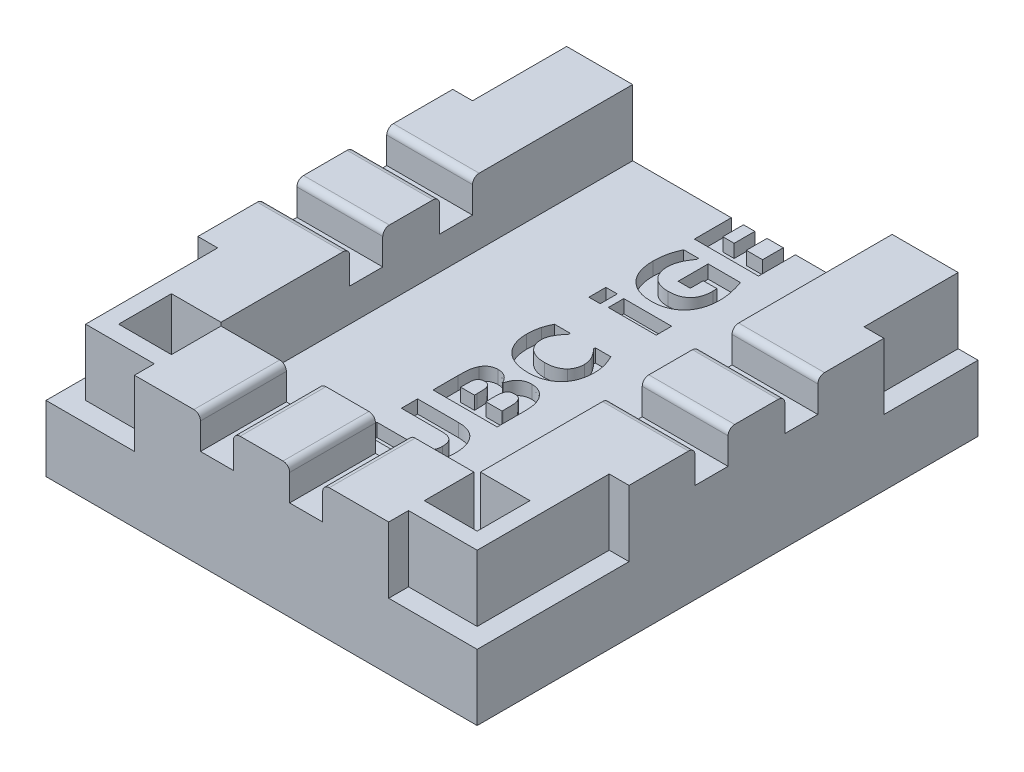
from build123d import *

# Parameters (mm, degrees)
SKETCH1_W                                  = 240
SKETCH1_H                                  = 200
BOSS_EXTRUDE1_DEPTH                        = 20
SKETCH7_W                                  = 120
SKETCH7_H                                  = 50
BOSS_EXTRUDE6_DEPTH                        = 20
FILLET1_R                                  = 2
SKETCH2_W                                  = 39.3
SKETCH2_H                                  = 125.7
CUT_EXTRUDE1_DEPTH                         = 10
CUT_EXTRUDE3_DEPTH                         = 5
MIRROR4_AT_THE_SECOND_PLANE_COPY_1_DEPTH   = 5
SKETCH11_W                                 = 104.748042719
SKETCH11_H                                 = 5
CUT_EXTRUDE4_DEPTH                         = 5
MIRROR6_AT_THE_SECOND_PLANE_COPY_1_SKETC_W = 104.748042719
MIRROR6_AT_THE_SECOND_PLANE_COPY_1_SKETC_H = 5
MIRROR6_AT_THE_SECOND_PLANE_COPY_1_DEPTH   = 5
SHELL1_START                               = 10
SHELL1_OUTLINE_W                           = 80.35
SHELL1_OUTLINE_H                           = 28.5
SHELL1_DEPTH                               = 10
FILLET3_R                                  = 1
SKETCH13_W                                 = 7.252545243
SKETCH13_H                                 = 2.335565418
SKETCH13_W_2                               = 1.720942939
SKETCH13_H_2                               = 2.581414408
CUT_EXTRUDE5_DEPTH                         = 2
CUT_EXTRUDE6_DEPTH                         = 10
MIRROR7_AT_THE_SECOND_PLANE_COPY_1_DEPTH   = 10
SKETCH15_W                                 = 101.789001661
SKETCH15_H                                 = 87.14110882
CUT_EXTRUDE7_DEPTH                         = 194.132079158
SKETCH16_W                                 = 296.201154453
SKETCH16_H                                 = 328.833485028
SKETCH16_W_2                               = 65.3
SKETCH16_H_2                               = 151.7
CUT_EXTRUDE10_DEPTH                        = 194.132079158
SKETCH17_W                                 = 70.628428311
SKETCH17_H                                 = 22.805656891
CUT_EXTRUDE11_DEPTH                        = 85.966140315


# Read off the part's stored shape, not the designer's step: Shell1
with BuildPart() as part:
    # Sketch1 → Boss-Extrude1 (new body)
    with BuildSketch(Plane(origin=(0, 0, 0), x_dir=(1, 0, 0), z_dir=(0, 1, 0))):
        Rectangle(SKETCH1_W, SKETCH1_H)
    extrude(amount=BOSS_EXTRUDE1_DEPTH)

    # Sketch7 → Boss-Extrude6 (add)
    with BuildSketch(Plane(origin=(0, 0, 0), x_dir=(1, 0, 0), z_dir=(0, 1, 0))):
        with Locations((0, 125)):
            Rectangle(SKETCH7_W, SKETCH7_H)
        with Locations((0, -125)):
            Rectangle(SKETCH7_W, SKETCH7_H)
    extrude(amount=BOSS_EXTRUDE6_DEPTH)

    # Fillet1
    fillet1_edges = [part.edges().sort_by_distance(p)[0] for p in [
        (-120, 20, 0),
        (90, 20, 100),
        (-90, 20, 100),
        (-60, 10, 150),
        (60, 10, 150),
        (-60, 20, 125),
        (0, 20, 150),
        (60, 20, 125),
        (-90, 20, -100),
        (60, 20, -125),
        (0, 20, -150),
        (60, 10, -150),
        (-60, 10, -150),
        (-60, 20, -125),
        (120, 20, 0),
        (120, 10, 100),
        (-120, 10, 100),
        (-120, 10, -100),
        (120, 10, -100),
        (90, 20, -100),
    ]]
    fillet(fillet1_edges, radius=FILLET1_R)

    # Sketch2 → Cut-Extrude1 (cut)
    with BuildSketch(Plane(origin=(0, 20, 0), x_dir=(1, 0, 0), z_dir=(0, 1, 0))):
        Rectangle(SKETCH2_W, SKETCH2_H)
    extrude(amount=-CUT_EXTRUDE1_DEPTH, mode=Mode.SUBTRACT)

    # Sketch10 → Cut-Extrude3 (cut)
    with BuildSketch(Plane(origin=(0, 20, 0), x_dir=(1, 0, 0), z_dir=(0, 1, 0))):
        Polygon((-9.25, -40.5), (-9.25, -33.162899401), (-4.25, -33.162899401), (-4.25, -40.5), (-4.25, -156.832928994), (-9.25, -156.832928994), align=None)
    cut_extrude3 = extrude(amount=-CUT_EXTRUDE3_DEPTH, mode=Mode.SUBTRACT)

    # Mirror4: Cut-Extrude3 across plane
    add(cut_extrude3.mirror(Plane(origin=(0, 0, 0), x_dir=(0, 0, 1), z_dir=(1, 0, 0))), mode=Mode.SUBTRACT)

    # Mirror4 at the second plane: Cut-Extrude3 across plane
    add(cut_extrude3.mirror(Plane.XY), mode=Mode.SUBTRACT)

    # Mirror4 at the second plane copy 1 sketc → Mirror4 at the second plane copy 1 (cut)
    with BuildSketch(Plane(origin=(0, 20, 0), x_dir=(-1, 0, 0), z_dir=(0, 1, 0))):
        Polygon((-9.25, -40.5), (-9.25, -33.162899401), (-4.25, -33.162899401), (-4.25, -40.5), (-4.25, -156.832928994), (-9.25, -156.832928994), align=None)
    extrude(amount=-MIRROR4_AT_THE_SECOND_PLANE_COPY_1_DEPTH, mode=Mode.SUBTRACT)

    # Sketch11 → Cut-Extrude4 (cut)
    with BuildSketch(Plane(origin=(0, 20, 0), x_dir=(1, 0, 0), z_dir=(0, 1, 0))):
        with Locations((-72.024021359, 26.75)):
            Rectangle(SKETCH11_W, SKETCH11_H)
        with Locations((-72.024021359, 40.35)):
            Rectangle(SKETCH11_W, SKETCH11_H)
    cut_extrude4 = extrude(amount=-CUT_EXTRUDE4_DEPTH, mode=Mode.SUBTRACT)

    # Mirror6: Cut-Extrude4 across plane
    add(cut_extrude4.mirror(Plane.XY), mode=Mode.SUBTRACT)

    # Mirror6 at the second plane: Cut-Extrude4 across plane
    add(cut_extrude4.mirror(Plane(origin=(0, 0, 0), x_dir=(0, 0, 1), z_dir=(1, 0, 0))), mode=Mode.SUBTRACT)

    # Mirror6 at the second plane copy 1 sketc → Mirror6 at the second plane copy 1 (cut)
    with BuildSketch(Plane(origin=(0, 20, 0), x_dir=(-1, 0, 0), z_dir=(0, 1, 0))):
        with Locations((-72.024021359, 26.75)):
            Rectangle(MIRROR6_AT_THE_SECOND_PLANE_COPY_1_SKETC_W, MIRROR6_AT_THE_SECOND_PLANE_COPY_1_SKETC_H)
        with Locations((-72.024021359, 40.35)):
            Rectangle(MIRROR6_AT_THE_SECOND_PLANE_COPY_1_SKETC_W, MIRROR6_AT_THE_SECOND_PLANE_COPY_1_SKETC_H)
    extrude(amount=-MIRROR6_AT_THE_SECOND_PLANE_COPY_1_DEPTH, mode=Mode.SUBTRACT)

    # Shell1 outline → Shell1 (cut)
    with BuildSketch(Plane(origin=(0, 0, 0), x_dir=(1, 0, 0), z_dir=(0, 1, 0)).offset(SHELL1_START)):
        Polygon((-29.65, 72.85), (-19.25, 72.85), (-19.25, 140), (-50, 140), (-50, 90), (-110, 90), (-110, 52.85), (-29.65, 52.85), align=None)
        Polygon((19.25, 72.85), (29.65, 72.85), (29.65, 52.85), (110, 52.85), (110, 90), (50, 90), (50, 140), (19.25, 140), align=None)
        Polygon((-110, -52.85), (-110, -90), (-50, -90), (-50, -140), (-19.25, -140), (-19.25, -72.85), (-29.65, -72.85), (-29.65, -52.85), align=None)
        with Locations((-69.825, 0)):
            Rectangle(SHELL1_OUTLINE_W, SHELL1_OUTLINE_H)
        Polygon((29.65, -72.85), (19.25, -72.85), (19.25, -140), (50, -140), (50, -90), (110, -90), (110, -52.85), (29.65, -52.85), align=None)
        with Locations((69.825, 0)):
            Rectangle(SHELL1_OUTLINE_W, SHELL1_OUTLINE_H)
    extrude(amount=SHELL1_DEPTH, mode=Mode.SUBTRACT)

    # Fillet3
    fillet3_edges = [part.edges().sort_by_distance(p)[0] for p in [
        (-4.25, 16.5, 150),
        (-4.25, 19.414213562, 149.414213562),
        (-9.25, 16.5, 150),
        (-9.25, 19.414213562, 149.414213562),
        (-4.25, 20, 105.425),
        (-9.25, 20, 105.425),
        (-9.25, 19.414213562, -149.414213562),
        (-9.25, 16.5, -150),
        (-9.25, 20, -105.425),
        (-4.25, 16.5, -150),
        (-4.25, 19.414213562, -149.414213562),
        (-4.25, 20, -105.425),
        (9.25, 16.5, 150),
        (9.25, 20, 105.425),
        (9.25, 19.414213562, 149.414213562),
        (4.25, 16.5, 150),
        (4.25, 19.414213562, 149.414213562),
        (4.25, 20, 105.425),
        (4.25, 16.5, -150),
        (4.25, 19.414213562, -149.414213562),
        (9.25, 19.414213562, -149.414213562),
        (9.25, 16.5, -150),
        (4.25, 20, -105.425),
        (9.25, 20, -105.425),
        (-120, 16.5, -24.25),
        (-120, 16.5, -29.25),
        (-119.414213562, 19.414213562, -24.25),
        (-119.414213562, 19.414213562, -29.25),
        (-68.825, 20, -24.25),
        (-68.825, 20, -29.25),
        (-120, 16.5, -37.85),
        (-120, 16.5, -42.85),
        (-68.825, 20, -37.85),
        (-68.825, 20, -42.85),
        (-119.414213562, 19.414213562, -37.85),
        (-119.414213562, 19.414213562, -42.85),
        (68.825, 20, -29.25),
        (119.414213562, 19.414213562, -29.25),
        (119.414213562, 19.414213562, -24.25),
        (68.825, 20, -24.25),
        (120, 16.5, -29.25),
        (120, 16.5, -24.25),
        (68.825, 20, -42.85),
        (119.414213562, 19.414213562, -42.85),
        (119.414213562, 19.414213562, -37.85),
        (68.825, 20, -37.85),
        (120, 16.5, -42.85),
        (120, 16.5, -37.85),
        (-120, 16.5, 29.25),
        (-120, 16.5, 24.25),
        (-68.825, 20, 29.25),
        (-119.414213562, 19.414213562, 29.25),
        (-119.414213562, 19.414213562, 24.25),
        (-68.825, 20, 24.25),
        (-120, 16.5, 42.85),
        (-120, 16.5, 37.85),
        (-68.825, 20, 42.85),
        (-119.414213562, 19.414213562, 42.85),
        (-119.414213562, 19.414213562, 37.85),
        (-68.825, 20, 37.85),
        (120, 16.5, 24.25),
        (120, 16.5, 29.25),
        (119.414213562, 19.414213562, 24.25),
        (119.414213562, 19.414213562, 29.25),
        (68.825, 20, 24.25),
        (68.825, 20, 29.25),
        (120, 16.5, 37.85),
        (120, 16.5, 42.85),
        (68.825, 20, 37.85),
        (68.825, 20, 42.85),
        (119.414213562, 19.414213562, 37.85),
        (119.414213562, 19.414213562, 42.85),
    ]]
    fillet(fillet3_edges, radius=FILLET3_R)

    # Sketch13 → Cut-Extrude5 (cut)
    # profile 1 of 12: a face of its own
    with BuildSketch(Plane(origin=(0, 10, 0), x_dir=(1, 0, 0), z_dir=(0, 1, 0))):
        Polygon((2.787359078, 56.729654742), (2.787359078, 55.37748529), (5, 55.37748529), (5, 53.041919872), (2.787359078, 53.041919872), (2.787359078, 48.247864542), (0.880108701, 48.247864542), (-4.711035156, 52.886343558), (-4.711035156, 55.37748529), (0.943491644, 55.37748529), (0.943491644, 56.729654742), align=None)
        Polygon((0.943491644, 53.041919872), (-2.596349692, 53.041919872), (0.943491644, 50.110938929), align=None, mode=Mode.SUBTRACT)
    # profile 2 of 12: a face of its own
    with BuildSketch(Plane(origin=(0, 10, 0), x_dir=(1, 0, 0), z_dir=(0, 1, 0))):
        with BuildLine():
            Line((5, 47.141544081), (5, 39.520225351))
            Line((5, 39.520225351), (3.409664338, 39.520225351))
            add(Edge.make_bspline(
                [(3.409664338, 39.520225351), (3.190599668, 39.81675512), (2.747057383, 40.417141716), (2.167094132, 41.14339637), (1.704390868, 41.703253096), (1.381972101, 42.083056551), (1.083256561, 42.417759603), (0.887687077, 42.622007507), (0.79559811, 42.718182933)],
                knots=[0, 0, 0, 0, 1.605452287, 3.25057426, 4.046675402, 4.768563423, 5.420146126, 6, 6, 6, 6], degree=3))
            add(Edge.make_bspline(
                [(0.79559811, 42.718182933), (0.732570292, 42.782561984), (0.609352585, 42.908421315), (0.423765416, 43.085974145), (0.244476812, 43.249198615), (0.074088064, 43.400664381), (-0.092796487, 43.534082219), (-0.252790737, 43.654099684), (-0.406497488, 43.759962438), (-0.599845109, 43.881290453), (-0.837875375, 44.00401532), (-1.125540586, 44.112139625), (-1.412736444, 44.178491494), (-1.604945873, 44.187117789), (-1.699385013, 44.191356186)],
                knots=[0, 0, 0, 0, 1.090093853, 2.131104457, 3.107135244, 4.023908394, 4.888948297, 5.691514549, 6.4435893, 7.146498757, 8.452673016, 9.675803408, 10.85804184, 12, 12, 12, 12], degree=3))
            add(Edge.make_bspline(
                [(-1.699385013, 44.191356186), (-1.754483363, 44.189605987), (-1.861179083, 44.186216799), (-2.017224671, 44.167846758), (-2.162681909, 44.132103765), (-2.300488192, 44.087839319), (-2.42643972, 44.024206924), (-2.544199113, 43.950411254), (-2.650531499, 43.859818439), (-2.749307162, 43.758726543), (-2.834556733, 43.642742478), (-2.911599654, 43.517157005), (-2.971430142, 43.377241787), (-3.024398474, 43.226819474), (-3.063653395, 43.063897589), (-3.092633036, 42.889340485), (-3.109905835, 42.703165878), (-3.111960528, 42.574807759), (-3.113016713, 42.508827152)],
                knots=[0, 0, 0, 0, 1.058578686, 2.049894692, 3.010224385, 3.931750511, 4.822578239, 5.71281177, 6.594427321, 7.498813824, 8.420995957, 9.353043897, 10.321837571, 11.3367408, 12.413304787, 13.535187771, 14.732999458, 16, 16, 16, 16], degree=3))
            add(Edge.make_bspline(
                [(-3.113016713, 42.508827152), (-3.110052719, 42.405568465), (-3.104041103, 42.196137688), (-3.053985994, 41.878413923), (-2.980602684, 41.552282773), (-2.873221808, 41.222921491), (-2.74714341, 40.895094854), (-2.596251992, 40.578640505), (-2.438170844, 40.269132893), (-2.314289691, 40.074405983), (-2.252545243, 39.977350819)],
                knots=[0, 0, 0, 0, 0.914703558, 1.855215137, 2.844920106, 3.875005138, 4.922433174, 5.955639304, 6.981056277, 8, 8, 8, 8], degree=3))
            Line((-2.252545243, 39.977350819), (-2.252545243, 39.766074342))
            Line((-2.252545243, 39.766074342), (-4.363389317, 39.766074342))
            add(Edge.make_bspline(
                [(-4.363389317, 39.766074342), (-4.396975153, 39.85152697), (-4.470639347, 40.038951181), (-4.568658946, 40.352153969), (-4.66491051, 40.720660415), (-4.763825821, 41.132864511), (-4.849735205, 41.573321973), (-4.910075419, 42.024211578), (-4.95119256, 42.474770211), (-4.954991729, 42.775713815), (-4.956884148, 42.92561802)],
                knots=[0, 0, 0, 0, 0.681686624, 1.495150967, 2.435076171, 3.509887788, 4.642826517, 5.765734475, 6.887081194, 8, 8, 8, 8], degree=3))
            add(Edge.make_bspline(
                [(-4.956884148, 42.92561802), (-4.954912362, 43.072306092), (-4.951074185, 43.357841566), (-4.914531776, 43.772464491), (-4.853049644, 44.160650299), (-4.769612134, 44.521836328), (-4.662431161, 44.856562797), (-4.529987596, 45.163893905), (-4.371768891, 45.443672956), (-4.191325, 45.69718541), (-3.986517109, 45.920499957), (-3.762299213, 46.116633841), (-3.516918106, 46.283180062), (-3.250583577, 46.417510178), (-2.964907945, 46.521931142), (-2.659732708, 46.596780352), (-2.333869778, 46.641015432), (-2.109911454, 46.646854566), (-1.995172081, 46.649846099)],
                knots=[0, 0, 0, 0, 1.302669921, 2.535710425, 3.693104205, 4.791067539, 5.825099944, 6.810730835, 7.758000335, 8.67487823, 9.568447078, 10.443087854, 11.315285082, 12.19521531, 13.085757283, 14.011200708, 14.981089066, 16, 16, 16, 16], degree=3))
            add(Edge.make_bspline(
                [(-1.995172081, 46.649846099), (-1.918295051, 46.648245135), (-1.764899121, 46.645050664), (-1.536586701, 46.623146341), (-1.311198259, 46.589276583), (-1.089189633, 46.538876948), (-0.870129482, 46.472993238), (-0.653296175, 46.39436831), (-0.439122967, 46.302496277), (-0.229338943, 46.193054838), (-0.018163961, 46.072147599), (0.191952814, 45.932794317), (0.405837655, 45.781094454), (0.620958688, 45.614342324), (0.835471411, 45.430057751), (1.055741697, 45.23549192), (1.273520634, 45.021368665), (1.417594688, 44.872241147), (1.490889788, 44.796375188)],
                knots=[0, 0, 0, 0, 0.907170522, 1.810115022, 2.704515666, 3.595334857, 4.494160497, 5.402400165, 6.316123003, 7.242010315, 8.19323076, 9.186549597, 10.215937183, 11.28746875, 12.397107329, 13.552885457, 14.755074217, 16, 16, 16, 16], degree=3))
            add(Edge.make_bspline(
                [(1.490889788, 44.796375188), (1.669671754, 44.600991906), (2.021428479, 44.216571794), (2.422503942, 43.720261203), (2.710127438, 43.347225494), (2.892573427, 43.11547907), (3.035611297, 42.923413887), (3.11966375, 42.809753418), (3.156132565, 42.760438229)],
                knots=[0, 0, 0, 0, 1.811045763, 3.563265038, 4.362127914, 5.033096026, 5.580478129, 6, 6, 6, 6], degree=3))
            Line((3.156132565, 42.760438229), (3.156132565, 47.141544081))
            Line((3.156132565, 47.141544081), (5, 47.141544081))
        make_face()
    # profile 3 of 12: a face of its own
    with BuildSketch(Plane(origin=(0, 10, 0), x_dir=(1, 0, 0), z_dir=(0, 1, 0))):
        with BuildLine():
            add(Edge.make_bspline(
                [(0.138720336, 37.553433421), (0.339837036, 37.551198694), (0.731017162, 37.546852061), (1.301575539, 37.503210957), (1.839727263, 37.435290008), (2.344336806, 37.340402007), (2.812295891, 37.218717557), (3.235819492, 37.059739443), (3.620265586, 36.877229499), (3.845547684, 36.720963882), (3.955141787, 36.64494457)],
                knots=[0, 0, 0, 0, 1.210994604, 2.355433537, 3.443919748, 4.476135166, 5.446013627, 6.351277171, 7.197937607, 8, 8, 8, 8], degree=3))
            add(Edge.make_bspline(
                [(3.955141787, 36.64494457), (4.057367971, 36.5617232), (4.260610648, 36.396265258), (4.524020765, 36.101981434), (4.745368417, 35.772676286), (4.897303004, 35.472877401), (4.999247268, 35.217133399), (5.063592063, 35.011802969), (5.122267484, 34.796985151), (5.167723638, 34.570405454), (5.201934481, 34.333084121), (5.226664862, 34.085073274), (5.242295446, 33.825562266), (5.244648027, 33.648682389), (5.245848991, 33.558387312)],
                knots=[0, 0, 0, 0, 1.363120718, 2.710110989, 4.070537742, 5.460816644, 6.180869889, 6.918733188, 7.687278466, 8.485437086, 9.309407483, 10.168795045, 11.065191617, 12, 12, 12, 12], degree=3))
            add(Edge.make_bspline(
                [(5.245848991, 33.558387312), (5.241905689, 33.384062955), (5.234297073, 33.047703496), (5.173081199, 32.562988904), (5.069699732, 32.118069919), (4.926806373, 31.711596248), (4.739854178, 31.34454147), (4.516760058, 31.013155063), (4.251279595, 30.717979546), (4.045332533, 30.554230832), (3.94169692, 30.471830054)],
                knots=[0, 0, 0, 0, 1.200851745, 2.317047666, 3.359233085, 4.342911255, 5.278031965, 6.189548012, 7.088953741, 8, 8, 8, 8], degree=3))
            add(Edge.make_bspline(
                [(3.94169692, 30.471830054), (3.829424185, 30.3947628), (3.600170882, 30.2373967), (3.214838014, 30.049115343), (2.792701976, 29.89168932), (2.331256748, 29.768085058), (1.834031119, 29.675388633), (1.301418942, 29.61187027), (0.734794995, 29.570336966), (0.344952566, 29.565716964), (0.144482422, 29.563341204)],
                knots=[0, 0, 0, 0, 0.822750793, 1.680001256, 2.58557045, 3.544707477, 4.565467581, 5.642347189, 6.787615291, 8, 8, 8, 8], degree=3))
            add(Edge.make_bspline(
                [(0.144482422, 29.563341204), (-0.061754837, 29.565532126), (-0.459970452, 29.569762495), (-1.036345286, 29.613069323), (-1.570746564, 29.680774054), (-2.065452333, 29.775711056), (-2.521358164, 29.900947264), (-2.938473361, 30.06222162), (-3.323134476, 30.249194002), (-3.55325365, 30.406272972), (-3.666176943, 30.483354226)],
                knots=[0, 0, 0, 0, 1.242237956, 2.39858964, 3.479780431, 4.485821505, 5.430991799, 6.32348679, 7.177307181, 8, 8, 8, 8], degree=3))
            add(Edge.make_bspline(
                [(-3.666176943, 30.483354226), (-3.769193286, 30.566416838), (-3.974708441, 30.732124775), (-4.238285133, 31.029639616), (-4.461065672, 31.362253167), (-4.645070962, 31.729678272), (-4.784115122, 32.135791847), (-4.885860052, 32.577168574), (-4.944671996, 33.056148657), (-4.952723667, 33.387282789), (-4.956884148, 33.558387312)],
                knots=[0, 0, 0, 0, 0.915406887, 1.826214983, 2.74012738, 3.682217607, 4.664024873, 5.706462388, 6.814877053, 8, 8, 8, 8], degree=3))
            add(Edge.make_bspline(
                [(-4.956884148, 33.558387312), (-4.955682618, 33.64868302), (-4.953320425, 33.826203271), (-4.937576888, 34.086978277), (-4.913381513, 34.337057391), (-4.877300412, 34.575699285), (-4.828262853, 34.80214551), (-4.773499009, 35.018778584), (-4.706561244, 35.224310597), (-4.601886899, 35.480626422), (-4.447267393, 35.781827029), (-4.217150947, 36.109134402), (-3.948246131, 36.405401156), (-3.739143401, 36.569659884), (-3.633525124, 36.652627351)],
                knots=[0, 0, 0, 0, 0.927772364, 1.823989051, 2.683453821, 3.508702832, 4.302191287, 5.063276402, 5.803871599, 6.520953588, 7.906777029, 9.27188215, 10.622021304, 12, 12, 12, 12], degree=3))
            add(Edge.make_bspline(
                [(-3.633525124, 36.652627351), (-3.521300204, 36.729189524), (-3.292789343, 36.885084383), (-2.908970475, 37.068290297), (-2.492360426, 37.225455121), (-2.036263275, 37.346342452), (-1.54437137, 37.439204828), (-1.015826808, 37.505677425), (-0.450933502, 37.546286922), (-0.061742996, 37.551003841), (0.138720336, 37.553433421)],
                knots=[0, 0, 0, 0, 0.826423845, 1.682753026, 2.582377666, 3.535958882, 4.552416628, 5.629628825, 6.779074777, 8, 8, 8, 8], degree=3))
        make_face()
        with BuildLine():
            add(Edge.make_bspline(
                [(0.138720336, 35.094943508), (-0.002794049, 35.093990238), (-0.275052116, 35.092156251), (-0.667644343, 35.074004214), (-1.028464631, 35.048543297), (-1.357952356, 35.010483072), (-1.656192237, 34.961169576), (-1.923473104, 34.900935006), (-2.158488294, 34.828227196), (-2.363936988, 34.745989678), (-2.54162794, 34.64913888), (-2.69467252, 34.537908006), (-2.823572221, 34.410664927), (-2.931286275, 34.270097317), (-3.011274034, 34.111739825), (-3.072443859, 33.941187009), (-3.106785969, 33.754382189), (-3.110895684, 33.625106618), (-3.113016713, 33.558387312)],
                knots=[0, 0, 0, 0, 1.684598718, 3.240982106, 4.677870026, 5.990101975, 7.188004416, 8.275163324, 9.249099904, 10.113910365, 10.905306099, 11.652292794, 12.358339015, 13.054983843, 13.750418457, 14.461547751, 15.206002611, 16, 16, 16, 16], degree=3))
            add(Edge.make_bspline(
                [(-3.113016713, 33.558387312), (-3.110895681, 33.491668012), (-3.106785962, 33.362392453), (-3.072443884, 33.175587552), (-3.011273943, 33.005035023), (-2.931286606, 32.84667649), (-2.823570979, 32.706112772), (-2.694677343, 32.578854684), (-2.541608299, 32.467684345), (-2.363496496, 32.37029911), (-2.157013742, 32.289020864), (-1.921590867, 32.215742751), (-1.654258135, 32.155647372), (-1.355414385, 32.106122047), (-1.024612933, 32.068276855), (-0.661244964, 32.04269777), (-0.266085327, 32.024665897), (0.008090715, 32.022799039), (0.150244508, 32.021831116)],
                knots=[0, 0, 0, 0, 0.791766581, 1.534129826, 2.243261137, 2.936741863, 3.631429404, 4.335491923, 5.08037989, 5.869552125, 6.738971147, 7.710171362, 8.794275798, 9.988812621, 11.304907075, 12.745337551, 14.312534512, 16, 16, 16, 16], degree=3))
            add(Edge.make_bspline(
                [(0.150244508, 32.021831116), (0.289201434, 32.022765136), (0.556986265, 32.024565091), (0.943773412, 32.043063349), (1.30096878, 32.067483158), (1.627502144, 32.109075315), (1.924420257, 32.156514098), (2.190195476, 32.220950105), (2.427221865, 32.292197549), (2.635687527, 32.376524358), (2.816464841, 32.475577579), (2.974492505, 32.586386469), (3.106149375, 32.714997304), (3.215613674, 32.855867424), (3.298888327, 33.012083539), (3.358752163, 33.181622444), (3.396338685, 33.365314373), (3.400067537, 33.492898418), (3.401981557, 33.558387312)],
                knots=[0, 0, 0, 0, 1.658832269, 3.196746878, 4.622488866, 5.931787449, 7.125569234, 8.210133994, 9.194149195, 10.078471196, 10.889203548, 11.650697572, 12.375032472, 13.07829054, 13.77251817, 14.478471121, 15.218999177, 16, 16, 16, 16], degree=3))
            add(Edge.make_bspline(
                [(3.401981557, 33.558387312), (3.400068186, 33.623876875), (3.3963406, 33.751462223), (3.358745104, 33.935144911), (3.298913291, 34.10471679), (3.215521541, 34.260812329), (3.106775331, 34.40178813), (2.97377315, 34.528364287), (2.816557237, 34.639341559), (2.635707586, 34.738476019), (2.42683161, 34.821967534), (2.190341985, 34.897522561), (1.921851262, 34.956560743), (1.624132619, 35.009519497), (1.295502071, 35.045529443), (0.936895825, 35.074962985), (0.547988509, 35.091838226), (0.278306115, 35.093884415), (0.138720336, 35.094943508)],
                knots=[0, 0, 0, 0, 0.778971247, 1.517574904, 2.221693305, 2.914116855, 3.615547377, 4.332711038, 5.092226179, 5.900851692, 6.782875619, 7.766611013, 8.854037796, 10.053520173, 11.366075456, 12.788704916, 14.337855446, 16, 16, 16, 16], degree=3))
        make_face(mode=Mode.SUBTRACT)
    # profile 4 of 12: a face of its own
    with BuildSketch(Plane(origin=(0, 10, 0), x_dir=(1, 0, 0), z_dir=(0, 1, 0))):
        with BuildLine():
            Line((5, 28.211171751), (5, 20.589853021))
            Line((5, 20.589853021), (3.409664338, 20.589853021))
            add(Edge.make_bspline(
                [(3.409664338, 20.589853021), (3.190599668, 20.88638279), (2.747057383, 21.486769386), (2.167094132, 22.21302404), (1.704390868, 22.772880767), (1.381972101, 23.152684221), (1.083256561, 23.487387273), (0.887687077, 23.691635177), (0.79559811, 23.787810603)],
                knots=[0, 0, 0, 0, 1.605452287, 3.25057426, 4.046675402, 4.768563423, 5.420146126, 6, 6, 6, 6], degree=3))
            add(Edge.make_bspline(
                [(0.79559811, 23.787810603), (0.732570292, 23.852189654), (0.609352585, 23.978048985), (0.423765416, 24.155601815), (0.244476812, 24.318826285), (0.074088064, 24.470292051), (-0.092796487, 24.60370989), (-0.252790737, 24.723727355), (-0.406497488, 24.829590108), (-0.599845109, 24.950918123), (-0.837875375, 25.07364299), (-1.125540586, 25.181767295), (-1.412736444, 25.248119164), (-1.604945873, 25.256745459), (-1.699385013, 25.260983856)],
                knots=[0, 0, 0, 0, 1.090093853, 2.131104457, 3.107135244, 4.023908394, 4.888948297, 5.691514549, 6.4435893, 7.146498757, 8.452673016, 9.675803408, 10.85804184, 12, 12, 12, 12], degree=3))
            add(Edge.make_bspline(
                [(-1.699385013, 25.260983856), (-1.754483363, 25.259233658), (-1.861179083, 25.25584447), (-2.017224671, 25.237474428), (-2.162681909, 25.201731435), (-2.300488192, 25.157466989), (-2.42643972, 25.093834595), (-2.544199113, 25.020038924), (-2.650531499, 24.929446109), (-2.749307162, 24.828354213), (-2.834556733, 24.712370148), (-2.911599654, 24.586784675), (-2.971430142, 24.446869457), (-3.024398474, 24.296447144), (-3.063653395, 24.133525259), (-3.092633036, 23.958968155), (-3.109905835, 23.772793548), (-3.111960528, 23.644435429), (-3.113016713, 23.578454822)],
                knots=[0, 0, 0, 0, 1.058578686, 2.049894692, 3.010224385, 3.931750511, 4.822578239, 5.71281177, 6.594427321, 7.498813824, 8.420995957, 9.353043897, 10.321837571, 11.3367408, 12.413304787, 13.535187771, 14.732999458, 16, 16, 16, 16], degree=3))
            add(Edge.make_bspline(
                [(-3.113016713, 23.578454822), (-3.110052719, 23.475196136), (-3.104041103, 23.265765358), (-3.053985994, 22.948041593), (-2.980602684, 22.621910443), (-2.873221808, 22.292549161), (-2.74714341, 21.964722525), (-2.596251992, 21.648268175), (-2.438170844, 21.338760563), (-2.314289691, 21.144033653), (-2.252545243, 21.046978489)],
                knots=[0, 0, 0, 0, 0.914703558, 1.855215137, 2.844920106, 3.875005138, 4.922433174, 5.955639304, 6.981056277, 8, 8, 8, 8], degree=3))
            Line((-2.252545243, 21.046978489), (-2.252545243, 20.835702012))
            Line((-2.252545243, 20.835702012), (-4.363389317, 20.835702012))
            add(Edge.make_bspline(
                [(-4.363389317, 20.835702012), (-4.396975153, 20.92115464), (-4.470639347, 21.108578851), (-4.568658946, 21.421781639), (-4.66491051, 21.790288086), (-4.763825821, 22.202492181), (-4.849735205, 22.642949643), (-4.910075419, 23.093839248), (-4.95119256, 23.544397881), (-4.954991729, 23.845341485), (-4.956884148, 23.99524569)],
                knots=[0, 0, 0, 0, 0.681686624, 1.495150967, 2.435076171, 3.509887788, 4.642826517, 5.765734475, 6.887081194, 8, 8, 8, 8], degree=3))
            add(Edge.make_bspline(
                [(-4.956884148, 23.99524569), (-4.954912362, 24.141933762), (-4.951074185, 24.427469237), (-4.914531776, 24.842092162), (-4.853049644, 25.230277969), (-4.769612134, 25.591463998), (-4.662431161, 25.926190468), (-4.529987596, 26.233521576), (-4.371768891, 26.513300626), (-4.191325, 26.76681308), (-3.986517109, 26.990127627), (-3.762299213, 27.186261512), (-3.516918106, 27.352807733), (-3.250583577, 27.487137848), (-2.964907945, 27.591558812), (-2.659732708, 27.666408023), (-2.333869778, 27.710643103), (-2.109911454, 27.716482236), (-1.995172081, 27.719473769)],
                knots=[0, 0, 0, 0, 1.302669921, 2.535710425, 3.693104205, 4.791067539, 5.825099944, 6.810730835, 7.758000335, 8.67487823, 9.568447078, 10.443087854, 11.315285082, 12.19521531, 13.085757283, 14.011200708, 14.981089066, 16, 16, 16, 16], degree=3))
            add(Edge.make_bspline(
                [(-1.995172081, 27.719473769), (-1.918295051, 27.717872805), (-1.764899121, 27.714678334), (-1.536586701, 27.692774011), (-1.311198259, 27.658904253), (-1.089189633, 27.608504619), (-0.870129482, 27.542620908), (-0.653296175, 27.46399598), (-0.439122967, 27.372123947), (-0.229338943, 27.262682508), (-0.018163961, 27.141775269), (0.191952814, 27.002421987), (0.405837655, 26.850722124), (0.620958688, 26.683969994), (0.835471411, 26.499685422), (1.055741697, 26.30511959), (1.273520634, 26.090996335), (1.417594688, 25.941868817), (1.490889788, 25.866002858)],
                knots=[0, 0, 0, 0, 0.907170522, 1.810115022, 2.704515666, 3.595334857, 4.494160497, 5.402400165, 6.316123003, 7.242010315, 8.19323076, 9.186549597, 10.215937183, 11.28746875, 12.397107329, 13.552885457, 14.755074217, 16, 16, 16, 16], degree=3))
            add(Edge.make_bspline(
                [(1.490889788, 25.866002858), (1.669671754, 25.670619576), (2.021428479, 25.286199464), (2.422503942, 24.789888873), (2.710127438, 24.416853164), (2.892573427, 24.18510674), (3.035611297, 23.993041557), (3.11966375, 23.879381088), (3.156132565, 23.830065899)],
                knots=[0, 0, 0, 0, 1.811045763, 3.563265038, 4.362127914, 5.033096026, 5.580478129, 6, 6, 6, 6], degree=3))
            Line((3.156132565, 23.830065899), (3.156132565, 28.211171751))
            Line((3.156132565, 28.211171751), (5, 28.211171751))
        make_face()
    # profile 5 of 12: a face of its own
    with BuildSketch(Plane(origin=(0, 10, 0), x_dir=(1, 0, 0), z_dir=(0, 1, 0))):
        Polygon((5, 13.583156769), (5, 11.124666856), (-1.524601746, 11.124666856), (2.664434583, 9.338420279), (2.664434583, 7.625160121), (-1.524601746, 5.838913543), (5, 5.838913543), (5, 3.503348126), (-4.711035156, 3.503348126), (-4.711035156, 6.382470298), (0.125275469, 8.549014533), (-4.711035156, 10.709796683), (-4.711035156, 13.583156769), align=None)
    # profile 6 of 12: a face of its own
    with BuildSketch(Plane(origin=(0, 10, 0), x_dir=(1, 0, 0), z_dir=(0, 1, 0))):
        Polygon((5, 1.4136317), (5, -5.593064552), (-4.711035156, -5.593064552), (-4.711035156, 1.4136317), (-2.867167722, 1.4136317), (-2.867167722, -3.134574639), (-1.146224782, -3.134574639), (-1.146224782, 1.044858213), (0.697642652, 1.044858213), (0.697642652, -3.134574639), (3.156132565, -3.134574639), (3.156132565, 1.4136317), align=None)
    # profile 7 of 12: a face of its own
    with BuildSketch(Plane(origin=(0, 10, 0), x_dir=(1, 0, 0), z_dir=(0, 1, 0))):
        with BuildLine():
            add(Edge.make_bspline(
                [(4.475650198, -7.805705474), (4.519354839, -7.923859504), (4.612512661, -8.17570855), (4.743574124, -8.583890089), (4.866671289, -9.047274178), (4.996208031, -9.552124696), (5.106381276, -10.084227717), (5.187397941, -10.625264318), (5.237323662, -11.165972628), (5.243010567, -11.526628491), (5.245848991, -11.706637515)],
                knots=[0, 0, 0, 0, 0.756485239, 1.612472169, 2.573171414, 3.635272123, 4.742182008, 5.834553763, 6.919191659, 8, 8, 8, 8], degree=3))
            add(Edge.make_bspline(
                [(5.245848991, -11.706637515), (5.241962961, -11.909112321), (5.234392087, -12.303579456), (5.17063924, -12.878829296), (5.062937634, -13.419584917), (4.916847086, -13.928231287), (4.72267015, -14.400885619), (4.491042888, -14.842463027), (4.211679163, -15.247896521), (3.893490591, -15.618759753), (3.53655883, -15.9505899), (3.145758166, -16.239699566), (2.72146993, -16.48347792), (2.264846611, -16.681095463), (1.776896349, -16.838089964), (1.255150105, -16.944841813), (0.702111097, -17.014888699), (0.322052776, -17.021601157), (0.127196165, -17.025042647)],
                knots=[0, 0, 0, 0, 1.160705024, 2.261318311, 3.313123859, 4.319096107, 5.290496718, 6.238021168, 7.172737693, 8.107230733, 9.03451477, 9.961071912, 10.888559376, 11.833805606, 12.808979065, 13.821966168, 14.883317984, 16, 16, 16, 16], degree=3))
            add(Edge.make_bspline(
                [(0.127196165, -17.025042647), (-0.058682323, -17.02067815), (-0.422730133, -17.012130168), (-0.955049114, -16.943336637), (-1.460067022, -16.832867692), (-1.937766829, -16.677677821), (-2.386372436, -16.473696921), (-2.808700267, -16.227656485), (-3.203463564, -15.935836699), (-3.565000576, -15.598836264), (-3.895700628, -15.226075236), (-4.177610929, -14.810267907), (-4.422741814, -14.363406013), (-4.616779655, -13.8775432), (-4.772219277, -13.359136807), (-4.876169413, -12.804694831), (-4.946971316, -12.216810998), (-4.953520434, -11.812500101), (-4.956884148, -11.604840667)],
                knots=[0, 0, 0, 0, 1.061573339, 2.079118747, 3.060574866, 4.011305467, 4.942696719, 5.870461571, 6.798745348, 7.740825567, 8.68941507, 9.638984161, 10.604583371, 11.595514188, 12.621960228, 13.691449096, 14.814297672, 16, 16, 16, 16], degree=3))
            add(Edge.make_bspline(
                [(-4.956884148, -11.604840667), (-4.954318925, -11.445386322), (-4.949235323, -11.129389392), (-4.919388643, -10.661251886), (-4.863951384, -10.205248288), (-4.792453594, -9.753475749), (-4.684946461, -9.294730481), (-4.534849919, -8.818874824), (-4.346707534, -8.316660693), (-4.193287983, -7.980233106), (-4.113698935, -7.805705474)],
                knots=[0, 0, 0, 0, 0.974479143, 1.931163549, 2.86485946, 3.780778834, 4.725046501, 5.741022375, 6.828116267, 8, 8, 8, 8], degree=3))
            Line((-4.113698935, -7.805705474), (-1.883771756, -7.805705474))
            Line((-1.883771756, -7.805705474), (-1.883771756, -8.091889065))
            add(Edge.make_bspline(
                [(-1.883771756, -8.091889065), (-1.906716104, -8.126531064), (-1.957410079, -8.203070203), (-2.043059993, -8.326945943), (-2.137489474, -8.476111594), (-2.284548962, -8.694884397), (-2.45960062, -8.978067997), (-2.581693909, -9.213466955), (-2.640525683, -9.326896107)],
                knots=[0, 0, 0, 0, 0.515980687, 1.140024195, 1.869947604, 2.707876564, 4.413660046, 6, 6, 6, 6], degree=3))
            add(Edge.make_bspline(
                [(-2.640525683, -9.326896107), (-2.672756546, -9.393740863), (-2.73882048, -9.530753251), (-2.823836627, -9.749019276), (-2.905177649, -9.981830174), (-2.978097, -10.22950925), (-3.037034138, -10.489919732), (-3.082413494, -10.759686706), (-3.106467195, -11.03779789), (-3.110821171, -11.225783758), (-3.113016713, -11.320577771)],
                knots=[0, 0, 0, 0, 0.861448091, 1.765719082, 2.717953576, 3.724891765, 4.761927522, 5.816719679, 6.89905606, 8, 8, 8, 8], degree=3))
            add(Edge.make_bspline(
                [(-3.113016713, -11.320577771), (-3.110164997, -11.430782772), (-3.104578279, -11.646682304), (-3.068710383, -11.963218824), (-3.004292393, -12.263584213), (-2.918860854, -12.549882667), (-2.805175217, -12.820581595), (-2.662381265, -13.075068024), (-2.499039638, -13.320076357), (-2.36711736, -13.466852812), (-2.300562624, -13.540901474)],
                knots=[0, 0, 0, 0, 1.091217493, 2.137773647, 3.148547478, 4.129133693, 5.092188092, 6.048375109, 7.015406034, 8, 8, 8, 8], degree=3))
            add(Edge.make_bspline(
                [(-2.300562624, -13.540901474), (-2.231129169, -13.608753509), (-2.090799964, -13.745886571), (-1.846186727, -13.91943259), (-1.579009792, -14.07619004), (-1.283734201, -14.208811415), (-0.962723927, -14.314570988), (-0.616833633, -14.387928819), (-0.248028071, -14.435679856), (0.006035391, -14.440927383), (0.136799641, -14.443628239)],
                knots=[0, 0, 0, 0, 0.871242595, 1.760833901, 2.686460846, 3.652134751, 4.663748384, 5.717797841, 6.825370436, 8, 8, 8, 8], degree=3))
            add(Edge.make_bspline(
                [(0.136799641, -14.443628239), (0.270078203, -14.441217619), (0.528956778, -14.436535262), (0.904701948, -14.395518364), (1.257245759, -14.329288021), (1.585144219, -14.233472949), (1.889752999, -14.11198958), (2.170660406, -13.964565335), (2.424839249, -13.78559248), (2.657673098, -13.584235453), (2.862193118, -13.352834409), (3.041867765, -13.096983341), (3.191530728, -12.813783401), (3.315763592, -12.506455713), (3.407777269, -12.172177215), (3.477785429, -11.813452581), (3.51753353, -11.428392977), (3.522401475, -11.163169785), (3.524906052, -11.026711399)],
                knots=[0, 0, 0, 0, 1.162877018, 2.258757441, 3.29433279, 4.289818334, 5.235063129, 6.152415668, 7.05144509, 7.94239879, 8.832861761, 9.739671241, 10.664582224, 11.622279774, 12.626959197, 13.685538709, 14.809200461, 16, 16, 16, 16], degree=3))
            add(Edge.make_bspline(
                [(3.524906052, -11.026711399), (3.524545414, -10.976125561), (3.523787414, -10.869802624), (3.51698298, -10.707868976), (3.511542352, -10.544994826), (3.50110347, -10.438303115), (3.496095624, -10.387119882)],
                knots=[0, 0, 0, 0, 0.947728294, 1.991965744, 3.036685378, 4, 4, 4, 4], degree=3))
            Line((3.496095624, -10.387119882), (1.435189626, -10.387119882))
            Line((1.435189626, -10.387119882), (1.435189626, -12.353911813))
            Line((1.435189626, -12.353911813), (-0.408677809, -12.353911813))
            Line((-0.408677809, -12.353911813), (-0.408677809, -7.805705474))
            Line((-0.408677809, -7.805705474), (4.475650198, -7.805705474))
        make_face()
    # profile 8 of 12: a face of its own
    with BuildSketch(Plane(origin=(0, 10, 0), x_dir=(1, 0, 0), z_dir=(0, 1, 0))):
        with Locations((1.373727378, -19.913768295)):
            Rectangle(SKETCH13_W, SKETCH13_H)
    # profile 9 of 12: a face of its own
    with BuildSketch(Plane(origin=(0, 10, 0), x_dir=(1, 0, 0), z_dir=(0, 1, 0))):
        with Locations((-4.219337174, -19.913768295)):
            Rectangle(SKETCH13_W_2, SKETCH13_H_2)
    # profile 10 of 12: a face of its own
    with BuildSketch(Plane(origin=(0, 10, 0), x_dir=(1, 0, 0), z_dir=(0, 1, 0))):
        with BuildLine():
            add(Edge.make_bspline(
                [(5.245848991, -30.773379208), (5.241556228, -30.949600555), (5.233101922, -31.296656552), (5.17328717, -31.807137753), (5.071443943, -32.296870987), (4.929457053, -32.76358831), (4.750483589, -33.205121013), (4.527408056, -33.614715808), (4.267338932, -33.994815031), (4.061606502, -34.220067298), (3.958983177, -34.332427496)],
                knots=[0, 0, 0, 0, 1.089850102, 2.146385891, 3.173869964, 4.179760968, 5.160008291, 6.115072822, 7.059761785, 8, 8, 8, 8], degree=3))
            add(Edge.make_bspline(
                [(3.958983177, -34.332427496), (3.848038568, -34.438295465), (3.624492228, -34.651612698), (3.240912088, -34.92404395), (2.819806379, -35.161121156), (2.440058042, -35.326067869), (2.118408243, -35.437370727), (1.865302565, -35.510926057), (1.602961267, -35.571890876), (1.331038558, -35.621175666), (1.050675199, -35.662875321), (0.76008365, -35.687900337), (0.460358885, -35.70657835), (0.257194686, -35.708560179), (0.154085898, -35.709565986)],
                knots=[0, 0, 0, 0, 1.326589366, 2.672993315, 4.060770367, 5.505883836, 6.25107509, 7.007321983, 7.7873399, 8.582269437, 9.400071632, 10.240855478, 11.107208546, 12, 12, 12, 12], degree=3))
            add(Edge.make_bspline(
                [(0.154085898, -35.709565986), (-0.036260272, -35.705853317), (-0.409159179, -35.698579988), (-0.954067146, -35.631518817), (-1.472101576, -35.524248732), (-1.962272567, -35.375865598), (-2.421254864, -35.182794221), (-2.847342954, -34.951680217), (-3.242424741, -34.683652344), (-3.47520079, -34.471076121), (-3.591269829, -34.365079315)],
                knots=[0, 0, 0, 0, 1.119324668, 2.1928203, 3.223958197, 4.228260008, 5.200520162, 6.147632129, 7.076354466, 8, 8, 8, 8], degree=3))
            add(Edge.make_bspline(
                [(-3.591269829, -34.365079315), (-3.696426816, -34.256022231), (-3.907914238, -34.036691095), (-4.17855444, -33.660997219), (-4.413868173, -33.249571895), (-4.610724175, -32.802820982), (-4.765892728, -32.325941651), (-4.877010675, -31.82562766), (-4.943259501, -31.303347455), (-4.952287649, -30.948354573), (-4.956884148, -30.767617122)],
                knots=[0, 0, 0, 0, 0.919195442, 1.8486482, 2.803167129, 3.793795735, 4.808307604, 5.844199062, 6.902417522, 8, 8, 8, 8], degree=3))
            add(Edge.make_bspline(
                [(-4.956884148, -30.767617122), (-4.956393428, -30.668359933), (-4.955436829, -30.474869682), (-4.94084827, -30.191814102), (-4.921289403, -29.923828157), (-4.879474294, -29.592200908), (-4.814808823, -29.204474119), (-4.7421777, -28.904822537), (-4.707193766, -28.760490591)],
                knots=[0, 0, 0, 0, 0.880714095, 1.716848845, 2.514717796, 3.264532192, 4.682418473, 6, 6, 6, 6], degree=3))
            add(Edge.make_bspline(
                [(-4.707193766, -28.760490591), (-4.664108705, -28.621612355), (-4.581310973, -28.354726269), (-4.434982607, -27.98111963), (-4.28414942, -27.652264541), (-4.186257609, -27.446632632), (-4.140588669, -27.350700282)],
                knots=[0, 0, 0, 0, 1.146660616, 2.203568899, 3.161920647, 4, 4, 4, 4], degree=3))
            Line((-4.140588669, -27.350700282), (-1.760847261, -27.350700282))
            Line((-1.760847261, -27.350700282), (-1.760847261, -27.636883873))
            add(Edge.make_bspline(
                [(-1.760847261, -27.636883873), (-1.789760882, -27.669445598), (-1.850028949, -27.737317837), (-1.943169449, -27.84646079), (-2.044289807, -27.966859077), (-2.193791638, -28.146156267), (-2.382825876, -28.396964235), (-2.52216278, -28.612309765), (-2.594428997, -28.723997382)],
                knots=[0, 0, 0, 0, 0.571444814, 1.191129738, 1.882836886, 2.634784766, 4.254652092, 6, 6, 6, 6], degree=3))
            add(Edge.make_bspline(
                [(-2.594428997, -28.723997382), (-2.664236929, -28.846886536), (-2.805685787, -29.09589163), (-2.943550161, -29.429418426), (-3.032587435, -29.709146116), (-3.077362003, -29.929392289), (-3.107853006, -30.156624515), (-3.111280534, -30.311028434), (-3.113016713, -30.389240159)],
                knots=[0, 0, 0, 0, 1.439173741, 2.916136845, 3.667290802, 4.427345131, 5.203387771, 6, 6, 6, 6], degree=3))
            add(Edge.make_bspline(
                [(-3.113016713, -30.389240159), (-3.110477824, -30.475745648), (-3.105440763, -30.647369353), (-3.07497042, -30.902187581), (-3.020147889, -31.150575186), (-2.946619655, -31.393340851), (-2.845477271, -31.627774464), (-2.718252775, -31.853674636), (-2.562057311, -32.070037457), (-2.439651919, -32.20231689), (-2.377390434, -32.269600803)],
                knots=[0, 0, 0, 0, 1.001598119, 1.9871338, 2.96553644, 3.943152672, 4.919306753, 5.914963555, 6.939446524, 8, 8, 8, 8], degree=3))
            add(Edge.make_bspline(
                [(-2.377390434, -32.269600803), (-2.309583745, -32.332034441), (-2.171025631, -32.45961311), (-1.93152049, -32.625206542), (-1.660665123, -32.770051169), (-1.360441958, -32.900067806), (-1.026703819, -33.004078191), (-0.659549693, -33.075068855), (-0.259970233, -33.119887624), (0.017588233, -33.125326369), (0.161768679, -33.128151577)],
                knots=[0, 0, 0, 0, 0.80388915, 1.642689914, 2.53299325, 3.481872775, 4.4947599, 5.577680681, 6.741702658, 8, 8, 8, 8], degree=3))
            add(Edge.make_bspline(
                [(0.161768679, -33.128151577), (0.311768837, -33.125923628), (0.599876693, -33.121644368), (1.011428999, -33.069407329), (1.386636838, -32.994288328), (1.721395513, -32.879071876), (2.020823568, -32.741957475), (2.287301408, -32.588864868), (2.521133588, -32.418332338), (2.653723475, -32.287257692), (2.71821405, -32.223504117)],
                knots=[0, 0, 0, 0, 1.290334302, 2.478367041, 3.565730986, 4.578276722, 5.517838544, 6.396912514, 7.220272109, 8, 8, 8, 8], degree=3))
            add(Edge.make_bspline(
                [(2.71821405, -32.223504117), (2.776624204, -32.15678903), (2.892154246, -32.024832576), (3.038823686, -31.808811236), (3.156499876, -31.579934787), (3.248205125, -31.341825956), (3.315689405, -31.098752861), (3.366730598, -30.856410279), (3.396189151, -30.615336617), (3.400060024, -30.45525906), (3.401981557, -30.375795292)],
                knots=[0, 0, 0, 0, 1.054325691, 2.085361559, 3.097224921, 4.110091334, 5.115626892, 6.095649915, 7.054665517, 8, 8, 8, 8], degree=3))
            add(Edge.make_bspline(
                [(3.401981557, -30.375795292), (3.399995416, -30.300167635), (3.396010997, -30.148450175), (3.367969377, -29.92183692), (3.324531763, -29.696128902), (3.260202951, -29.473850088), (3.18176618, -29.256712893), (3.091757836, -29.045457401), (2.985752349, -28.843934907), (2.905928292, -28.715220777), (2.866107583, -28.651010962)],
                knots=[0, 0, 0, 0, 0.991289386, 1.988636345, 2.989438367, 4.001683697, 5.01851186, 6.01479875, 7.009670459, 8, 8, 8, 8], degree=3))
            add(Edge.make_bspline(
                [(2.866107583, -28.651010962), (2.799086235, -28.54754028), (2.667016335, -28.343644611), (2.482727048, -28.10690862), (2.33514417, -27.932313621), (2.23417018, -27.813138173), (2.139586208, -27.707238781), (2.078704196, -27.641290482), (2.049812104, -27.60999414)],
                knots=[0, 0, 0, 0, 1.674278229, 3.299273488, 4.071081905, 4.780574956, 5.421311183, 6, 6, 6, 6], degree=3))
            Line((2.049812104, -27.60999414), (2.049812104, -27.350700282))
            Line((2.049812104, -27.350700282), (4.400743084, -27.350700282))
            add(Edge.make_bspline(
                [(4.400743084, -27.350700282), (4.453977989, -27.469107265), (4.557995254, -27.700466195), (4.710217804, -28.043257711), (4.853488894, -28.385337096), (4.925202683, -28.621478965), (4.961586095, -28.741283639)],
                knots=[0, 0, 0, 0, 1.037949104, 2.028079651, 2.999562103, 4, 4, 4, 4], degree=3))
            add(Edge.make_bspline(
                [(4.961586095, -28.741283639), (5.004421769, -28.893824294), (5.086847599, -29.1873481), (5.164067273, -29.560966602), (5.209771736, -29.869797121), (5.23105018, -30.136648007), (5.244470102, -30.442236078), (5.245371714, -30.658760047), (5.245848991, -30.773379208)],
                knots=[0, 0, 0, 0, 1.383532347, 2.662238992, 3.328886368, 4.109040656, 4.999001483, 6, 6, 6, 6], degree=3))
        make_face()
    # profile 11 of 12: a face of its own
    with BuildSketch(Plane(origin=(0, 10, 0), x_dir=(1, 0, 0), z_dir=(0, 1, 0))):
        with BuildLine():
            add(Edge.make_bspline(
                [(2.021001676, -36.938810942), (2.135834195, -36.941779245), (2.360423317, -36.947584644), (2.687160369, -37.003329886), (2.994969738, -37.09114997), (3.282415269, -37.214700456), (3.547482787, -37.370068437), (3.793917062, -37.547462735), (4.012640519, -37.757602713), (4.139226852, -37.914392754), (4.202911474, -37.993272632)],
                knots=[0, 0, 0, 0, 1.09475917, 2.141126953, 3.152168046, 4.142704369, 5.117043167, 6.078545687, 7.033330935, 8, 8, 8, 8], degree=3))
            add(Edge.make_bspline(
                [(4.202911474, -37.993272632), (4.271430436, -38.089328613), (4.40755836, -38.280164856), (4.576639788, -38.587433573), (4.713481332, -38.908937379), (4.823111743, -39.248810358), (4.903771308, -39.619354907), (4.959791089, -40.029680334), (4.994197282, -40.485748637), (4.998006227, -40.805105318), (5, -40.972270956)],
                knots=[0, 0, 0, 0, 0.900219365, 1.788482918, 2.670971805, 3.564424711, 4.510769046, 5.562163026, 6.723926581, 8, 8, 8, 8], degree=3))
            Line((5, -40.972270956), (5, -45.174752151))
            Line((5, -45.174752151), (-4.711035156, -45.174752151))
            Line((-4.711035156, -45.174752151), (-4.711035156, -41.425555034))
            add(Edge.make_bspline(
                [(-4.711035156, -41.425555034), (-4.710541486, -41.331439942), (-4.70958769, -41.149604829), (-4.705841049, -40.887095211), (-4.699877008, -40.643807445), (-4.693192491, -40.420271668), (-4.681063463, -40.216067051), (-4.668157953, -40.032247924), (-4.652477333, -39.867707729), (-4.630893633, -39.673277593), (-4.585539799, -39.443346024), (-4.510417909, -39.173669198), (-4.412392074, -38.905016505), (-4.330200075, -38.730862363), (-4.288482202, -38.642467624)],
                knots=[0, 0, 0, 0, 1.191100834, 2.301266995, 3.32247628, 4.271027234, 5.131271201, 5.911180066, 6.602939548, 7.223035301, 8.386250696, 9.563798057, 10.763466492, 12, 12, 12, 12], degree=3))
            add(Edge.make_bspline(
                [(-4.288482202, -38.642467624), (-4.24037863, -38.555082717), (-4.14649073, -38.384526039), (-3.96681891, -38.160482297), (-3.766354069, -37.969249234), (-3.540529018, -37.816186883), (-3.294523859, -37.699130329), (-3.031217773, -37.613886068), (-2.750649461, -37.563414018), (-2.558140696, -37.556803917), (-2.45998033, -37.553433421)],
                knots=[0, 0, 0, 0, 1.062471767, 2.073717987, 3.049750995, 4.008349348, 4.970663542, 5.946983296, 6.953165217, 8, 8, 8, 8], degree=3))
            add(Edge.make_bspline(
                [(-2.45998033, -37.553433421), (-2.34632125, -37.557744982), (-2.123212386, -37.56620843), (-1.799163202, -37.636330667), (-1.497547426, -37.755993777), (-1.217510903, -37.917931504), (-0.962107245, -38.123087774), (-0.737146443, -38.36942586), (-0.539239297, -38.653150081), (-0.437787245, -38.864281752), (-0.385629466, -38.972827206)],
                knots=[0, 0, 0, 0, 1.021240063, 2.004659125, 2.963527431, 3.928166968, 4.902700677, 5.896727327, 6.918681, 8, 8, 8, 8], degree=3))
            Line((-0.385629466, -38.972827206), (-0.331849999, -38.972827206))
            add(Edge.make_bspline(
                [(-0.331849999, -38.972827206), (-0.315133952, -38.896322572), (-0.282373011, -38.746384985), (-0.213507173, -38.530709186), (-0.135710337, -38.325903274), (-0.042627342, -38.133886296), (0.060108174, -37.95222046), (0.178686833, -37.784999106), (0.30692412, -37.628215042), (0.449935214, -37.485611469), (0.604749117, -37.357488018), (0.771277187, -37.24414347), (0.951207426, -37.150906864), (1.14137017, -37.070940795), (1.345153065, -37.011582244), (1.560063926, -36.970821996), (1.786533831, -36.941763667), (1.941515264, -36.939811939), (2.021001676, -36.938810942)],
                knots=[0, 0, 0, 0, 1.10181943, 2.159400495, 3.183738525, 4.183475208, 5.160528738, 6.118184526, 7.065606833, 8.008818544, 8.956240851, 9.891148262, 10.838570569, 11.80433507, 12.791067958, 13.819797808, 14.881824444, 16, 16, 16, 16], degree=3))
        make_face()
        with BuildLine():
            add(Edge.make_bspline(
                [(-2.008616947, -40.134847829), (-2.09124687, -40.140597316), (-2.261302737, -40.152430001), (-2.465096768, -40.229199103), (-2.617398636, -40.321814293), (-2.718430914, -40.417582821), (-2.802491285, -40.537481784), (-2.842505816, -40.628911056), (-2.863326331, -40.676483888)],
                knots=[0, 0, 0, 0, 1.37611365, 2.832099971, 3.575724026, 4.338646544, 5.135558161, 6, 6, 6, 6], degree=3))
            add(Edge.make_bspline(
                [(-2.863326331, -40.676483888), (-2.880469479, -40.72417013), (-2.916029188, -40.823084802), (-2.94872072, -40.98465552), (-2.971826297, -41.161780037), (-2.982379957, -41.360128266), (-2.984019117, -41.586254808), (-2.989034583, -41.849372132), (-2.990414961, -42.152857164), (-2.99020396, -42.369256934), (-2.990092217, -42.483858113)],
                knots=[0, 0, 0, 0, 0.667162118, 1.383881808, 2.166847079, 3.020689487, 3.999759839, 5.147588948, 6.489417668, 8, 8, 8, 8], degree=3))
            Line((-2.990092217, -42.483858113), (-2.990092217, -42.716262238))
            Line((-2.990092217, -42.716262238), (-0.900375791, -42.716262238))
            Line((-0.900375791, -42.716262238), (-0.900375791, -42.328281799))
            add(Edge.make_bspline(
                [(-0.900375791, -42.328281799), (-0.900847936, -42.234165701), (-0.901756934, -42.052968806), (-0.905752536, -41.792392548), (-0.910819984, -41.553515408), (-0.920304415, -41.336408066), (-0.933541808, -41.139837111), (-0.960203888, -40.965118006), (-0.996788228, -40.811145546), (-1.034375643, -40.719653209), (-1.052110715, -40.676483888)],
                knots=[0, 0, 0, 0, 1.353556646, 2.605933166, 3.748016522, 4.789499618, 5.731564706, 6.579319284, 7.329672576, 8, 8, 8, 8], degree=3))
            add(Edge.make_bspline(
                [(-1.052110715, -40.676483888), (-1.078045734, -40.62432659), (-1.126824949, -40.526227872), (-1.221120897, -40.399741201), (-1.326351499, -40.301159723), (-1.446667726, -40.235307443), (-1.574159605, -40.189253382), (-1.710236455, -40.157274444), (-1.856291435, -40.137362616), (-1.956690393, -40.1357051), (-2.008616947, -40.134847829)],
                knots=[0, 0, 0, 0, 1.185047103, 2.228865504, 3.19870776, 4.098528262, 5.002595673, 5.955169327, 6.942409244, 8, 8, 8, 8], degree=3))
        make_face(mode=Mode.SUBTRACT)
        with BuildLine():
            add(Edge.make_bspline(
                [(2.026763761, -39.520225351), (1.953023318, -39.522411502), (1.813066197, -39.52656075), (1.616130796, -39.557844442), (1.445067383, -39.613491155), (1.298621824, -39.693085665), (1.174285176, -39.801935168), (1.0706615, -39.94105928), (0.983868523, -40.11095373), (0.942352079, -40.237230881), (0.920443301, -40.303869011)],
                knots=[0, 0, 0, 0, 1.190735269, 2.259979371, 3.208234232, 4.083001629, 4.93316116, 5.855523917, 6.868331482, 8, 8, 8, 8], degree=3))
            add(Edge.make_bspline(
                [(0.920443301, -40.303869011), (0.906744847, -40.356816102), (0.877297832, -40.470634336), (0.849892481, -40.657796969), (0.834020824, -40.87213552), (0.821780201, -41.198149771), (0.823210929, -41.634925024), (0.821460992, -41.990885698), (0.820567148, -42.172705484)],
                knots=[0, 0, 0, 0, 0.524312437, 1.127093368, 1.81100824, 2.585413694, 4.255876569, 6, 6, 6, 6], degree=3))
            Line((0.820567148, -42.172705484), (0.820567148, -42.716262238))
            Line((0.820567148, -42.716262238), (3.279057061, -42.716262238))
            Line((3.279057061, -42.716262238), (3.279057061, -42.535716885))
            add(Edge.make_bspline(
                [(3.279057061, -42.535716885), (3.278974112, -42.451206672), (3.278814497, -42.288588535), (3.279912217, -42.054255856), (3.276233212, -41.83851166), (3.278151037, -41.641944513), (3.274338023, -41.463336919), (3.276045374, -41.303902128), (3.273109661, -41.162417415), (3.271730495, -41.000319704), (3.261895556, -40.813029002), (3.228612943, -40.599036272), (3.178483106, -40.393438891), (3.126331492, -40.264288854), (3.100432403, -40.200151468)],
                knots=[0, 0, 0, 0, 1.290084578, 2.482435477, 3.577096325, 4.583753231, 5.482956203, 6.303919117, 7.01744192, 7.643013823, 8.77878684, 9.876279933, 10.945336299, 12, 12, 12, 12], degree=3))
            add(Edge.make_bspline(
                [(3.100432403, -40.200151468), (3.071771625, -40.139887889), (3.017172805, -40.02508569), (2.916259015, -39.871286631), (2.794668554, -39.752871432), (2.661678362, -39.662072279), (2.515987473, -39.599481173), (2.362113362, -39.552829486), (2.197351176, -39.525972374), (2.084478576, -39.52216974), (2.026763761, -39.520225351)],
                knots=[0, 0, 0, 0, 1.176739053, 2.241689486, 3.223911615, 4.151030007, 5.066033208, 6.009243398, 6.982072299, 8, 8, 8, 8], degree=3))
        make_face(mode=Mode.SUBTRACT)
    # profile 12 of 12: a face of its own
    with BuildSketch(Plane(origin=(0, 10, 0), x_dir=(1, 0, 0), z_dir=(0, 1, 0))):
        with BuildLine():
            add(Edge.make_bspline(
                [(1.512017436, -47.510317568), (1.658117535, -47.513706434), (1.9428832, -47.520311719), (2.357411184, -47.5695508), (2.744982873, -47.656562292), (3.107029839, -47.774612183), (3.441363342, -47.930059691), (3.751964278, -48.116132586), (4.033217485, -48.341116319), (4.288224496, -48.598381297), (4.5168247, -48.887909948), (4.712363571, -49.212568176), (4.877148099, -49.568574773), (5.015348627, -49.955040345), (5.115871512, -50.3760664), (5.193849339, -50.827473253), (5.236960864, -51.311818098), (5.242825893, -51.644854467), (5.245848991, -51.816516306)],
                knots=[0, 0, 0, 0, 1.078483925, 2.102087493, 3.07563418, 4.006804974, 4.907686045, 5.792049102, 6.673413646, 7.559089302, 8.461147502, 9.390096458, 10.350078799, 11.353180003, 12.414700242, 13.541405865, 14.732730623, 16, 16, 16, 16], degree=3))
            add(Edge.make_bspline(
                [(5.245848991, -51.816516306), (5.242819772, -51.988177805), (5.236942866, -52.321213512), (5.193970738, -52.804933579), (5.115991584, -53.255099563), (5.014659113, -53.675222365), (4.87752742, -54.062007781), (4.712871176, -54.418223302), (4.51624682, -54.741586999), (4.288179492, -55.030698426), (4.033899302, -55.288346201), (3.75147891, -55.510143907), (3.443571052, -55.698318074), (3.108347061, -55.850128873), (2.74757355, -55.968687572), (2.361256189, -56.055795601), (1.948018425, -56.105122439), (1.663882602, -56.111667027), (1.517779522, -56.115032264)],
                knots=[0, 0, 0, 0, 1.269417573, 2.462761791, 3.586710223, 4.645434864, 5.654699426, 6.616309069, 7.542788968, 8.446376281, 9.33355328, 10.213474434, 11.09529141, 11.995722662, 12.928471919, 13.899049301, 14.919687896, 16, 16, 16, 16], degree=3))
            Line((1.517779522, -56.115032264), (-4.711035156, -56.115032264))
            Line((-4.711035156, -56.115032264), (-4.711035156, -53.656542351))
            Line((-4.711035156, -53.656542351), (1.387172245, -53.656542351))
            add(Edge.make_bspline(
                [(1.387172245, -53.656542351), (1.469143879, -53.654753254), (1.628192667, -53.651281887), (1.858859241, -53.633577339), (2.072848893, -53.597748315), (2.272029516, -53.55328104), (2.4547094, -53.491810495), (2.620461575, -53.416686258), (2.77098949, -53.330108084), (2.904599747, -53.227374233), (3.023312628, -53.109052565), (3.125598971, -52.974011118), (3.210086887, -52.821379119), (3.282279136, -52.653957703), (3.334269574, -52.467578025), (3.375509757, -52.265592455), (3.397699401, -52.046212521), (3.400524587, -51.894668614), (3.401981557, -51.816516306)],
                knots=[0, 0, 0, 0, 1.249777764, 2.424931999, 3.522345468, 4.554462307, 5.532762845, 6.454315708, 7.324685205, 8.173785143, 9.015675824, 9.872535868, 10.746508943, 11.66914632, 12.645058795, 13.690060112, 14.808747011, 16, 16, 16, 16], degree=3))
            add(Edge.make_bspline(
                [(3.401981557, -51.816516306), (3.400674296, -51.738979381), (3.398150748, -51.589301379), (3.374130292, -51.37303247), (3.338535545, -51.172391116), (3.287897797, -50.986899342), (3.217473982, -50.818948468), (3.135438424, -50.666383082), (3.038459421, -50.529190069), (2.923990148, -50.409636263), (2.793425817, -50.304652914), (2.645688893, -50.213790545), (2.480082864, -50.136937587), (2.295259376, -50.076535285), (2.09395566, -50.026099098), (1.874093338, -49.992230388), (1.636540145, -49.973845268), (1.472355051, -49.970528364), (1.387172245, -49.968807481)],
                knots=[0, 0, 0, 0, 1.177246587, 2.272567755, 3.300601858, 4.27032395, 5.185878586, 6.060498087, 6.896988092, 7.729228332, 8.566000887, 9.434926014, 10.357220516, 11.331999863, 12.383856098, 13.506125206, 14.706123391, 16, 16, 16, 16], degree=3))
            Line((1.387172245, -49.968807481), (-4.711035156, -49.968807481))
            Line((-4.711035156, -49.968807481), (-4.711035156, -47.510317568))
            Line((-4.711035156, -47.510317568), (1.512017436, -47.510317568))
        make_face()
    extrude(amount=-CUT_EXTRUDE5_DEPTH, mode=Mode.SUBTRACT)

    # Sketch14 → Cut-Extrude6 (cut)
    with BuildSketch(Plane(origin=(0, 20, 0), x_dir=(1, 0, 0), z_dir=(0, 1, 0))):
        Polygon((-27.15, 70.35), (-27.15, 62.35), (-19.65, 62.35), (-19.65, 62.85), (-19.15, 62.85), (-19.15, 70.35), align=None)
    cut_extrude6 = extrude(amount=-CUT_EXTRUDE6_DEPTH, mode=Mode.SUBTRACT)

    # Mirror7: Cut-Extrude6 across plane
    add(cut_extrude6.mirror(Plane(origin=(0, 0, 0), x_dir=(0, 0, 1), z_dir=(1, 0, 0))), mode=Mode.SUBTRACT)

    # Mirror7 at the second plane: Cut-Extrude6 across plane
    add(cut_extrude6.mirror(Plane.XY), mode=Mode.SUBTRACT)

    # Mirror7 at the second plane copy 1 sketc → Mirror7 at the second plane copy 1 (cut)
    with BuildSketch(Plane(origin=(0, 20, 0), x_dir=(-1, 0, 0), z_dir=(0, 1, 0))):
        Polygon((-27.15, 70.35), (-27.15, 62.35), (-19.65, 62.35), (-19.65, 62.85), (-19.15, 62.85), (-19.15, 70.35), align=None)
    extrude(amount=-MIRROR7_AT_THE_SECOND_PLANE_COPY_1_DEPTH, mode=Mode.SUBTRACT)

    # Sketch15 → Cut-Extrude7 (cut, through all)
    with BuildSketch(Plane(origin=(0, 20, 0), x_dir=(1, 0, 0), z_dir=(0, 1, 0))):
        with Locations((-83.544500831, 119.42055441)):
            Rectangle(SKETCH15_W, SKETCH15_H)
        with Locations((83.544500831, 119.42055441)):
            Rectangle(SKETCH15_W, SKETCH15_H)
        with Locations((83.544500831, -119.42055441)):
            Rectangle(SKETCH15_W, SKETCH15_H)
        with Locations((-83.544500831, -119.42055441)):
            Rectangle(SKETCH15_W, SKETCH15_H)
    extrude(amount=-CUT_EXTRUDE7_DEPTH, mode=Mode.SUBTRACT)

    # Sketch16 → Cut-Extrude10 (cut, through all)
    with BuildSketch(Plane(origin=(0, 20, 0), x_dir=(1, 0, 0), z_dir=(0, 1, 0))):
        with Locations((-0.107429472, 0.127566658)):
            Rectangle(SKETCH16_W, SKETCH16_H)
        Rectangle(SKETCH16_W_2, SKETCH16_H_2, mode=Mode.SUBTRACT)
    extrude(amount=-CUT_EXTRUDE10_DEPTH, mode=Mode.SUBTRACT)

    # Sketch17 → Cut-Extrude11 (cut, through all)
    with BuildSketch(Plane.XY):
        with Locations((0.898404665, 9.965445975)):
            Rectangle(SKETCH17_W, SKETCH17_H)
    extrude(amount=-CUT_EXTRUDE11_DEPTH, mode=Mode.SUBTRACT)


solid = part.part
